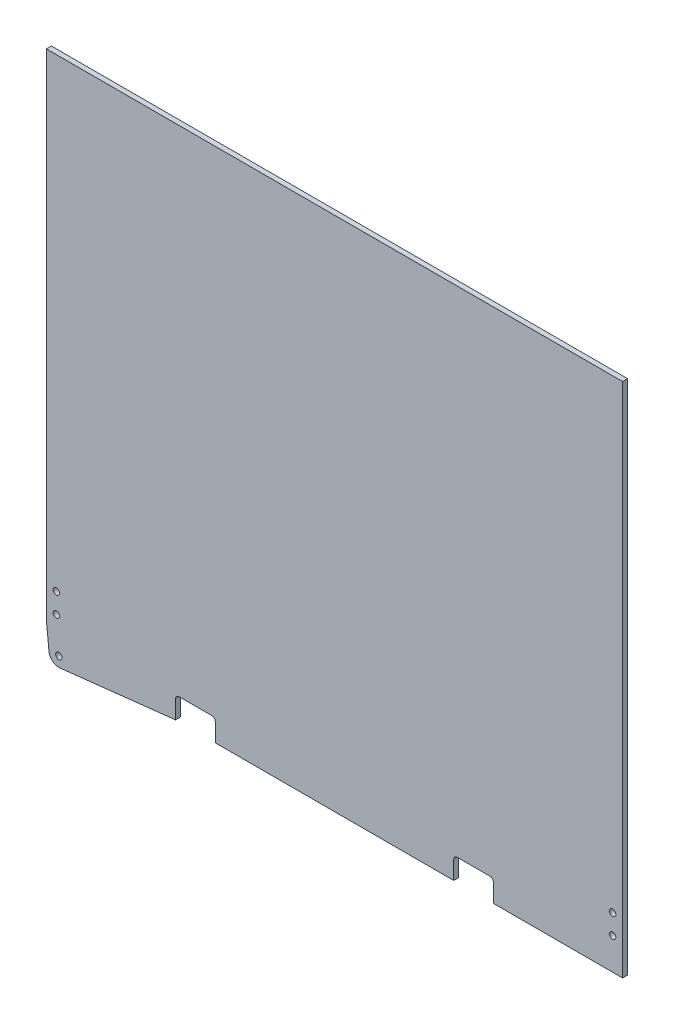
from build123d import *

# Parameters (mm, degrees)
SKETCH1_R           = 2.032
BOSS_EXTRUDE1_DEPTH = 3.175
FILLET1_R           = 2.286


with BuildPart() as part:
    # Sketch1 → Boss-Extrude1 (new body)
    with BuildSketch(Plane.XY):
        with BuildLine():
            Line((82.55, -20.32), (82.55, -6.35))
            Line((82.55, -6.35), (107.95, -6.35))
            Line((107.95, -6.35), (107.95, -20.32))
            Line((107.95, -20.32), (260.35, -20.32))
            Line((260.35, -20.32), (260.35, -6.35))
            Line((260.35, -6.35), (285.75, -6.35))
            Line((285.75, -6.35), (285.75, -20.32))
            Line((285.75, -20.32), (368.3, -20.32))
            Line((368.3, -20.32), (368.3, 309.88))
            Line((368.3, 309.88), (0, 309.88))
            Line((0, 309.88), (0, 0))
            Line((0, 0), (0, -6.35))
            ThreePointArc((0, -6.35), (0.007883354, -6.666317007), (0.031513842, -6.981848616))
            Line((0.031513842, -6.981848616), (1.619013842, -22.856848616))
            ThreePointArc((1.619013842, -22.856848616), (3.943628298, -27.161748811), (8.639060666, -28.536126099))
            Line((8.639060666, -28.536126099), (82.55, -20.32))
        make_face()
        with Locations((6.35, 0)):
            Circle(SKETCH1_R, mode=Mode.SUBTRACT)
        with Locations((6.35, 12.7)):
            Circle(SKETCH1_R, mode=Mode.SUBTRACT)
        with Locations((361.95, 0)):
            Circle(SKETCH1_R, mode=Mode.SUBTRACT)
        with Locations((361.95, 12.7)):
            Circle(SKETCH1_R, mode=Mode.SUBTRACT)
        with Locations((7.9375, -22.225)):
            Circle(SKETCH1_R, mode=Mode.SUBTRACT)
    extrude(amount=BOSS_EXTRUDE1_DEPTH)

    # Fillet1
    fillet1_edges = [part.edges().sort_by_distance(p)[0] for p in [
        (285.75, -6.35, 1.5875),
        (107.95, -6.35, 1.5875),
        (260.35, -6.35, 1.5875),
        (82.55, -6.35, 1.5875),
    ]]
    fillet(fillet1_edges, radius=FILLET1_R)


solid = part.part
